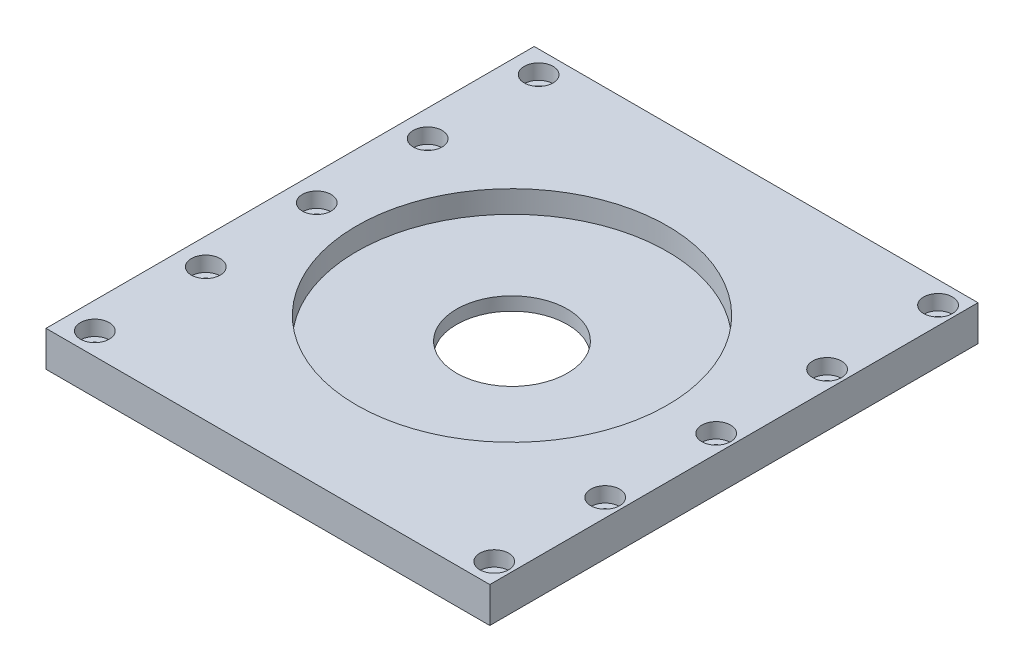
from build123d import *

# Parameters (mm, degrees)
SKETCH1_W                                           = 100
SKETCH1_H                                           = 110
BOSS_EXTRUDE1_DEPTH                                 = 8
CBORE_FOR_M3_HEX_SOCKET_HEAD_CAP_SCREW1_D           = 3.4
CBORE_FOR_M3_HEX_SOCKET_HEAD_CAP_SCREW1_DEPTH       = 8
CBORE_FOR_M3_HEX_SOCKET_HEAD_CAP_SCREW1_CBORE_D     = 6.5
CBORE_FOR_M3_HEX_SOCKET_HEAD_CAP_SCREW1_CBORE_DEPTH = 3.4
CBORE_FOR_M3_HEX_SOCKET_HEAD_CAP_SCREW1_TIP         = 1.021463052
F_25_0MM_DOWEL_HOLE1_D                              = 25
F_25_0MM_DOWEL_HOLE1_DEPTH                          = 10
F_25_0MM_DOWEL_HOLE1_TIP                            = 7.510757738
SKETCH7_R                                           = 35
CUT_EXTRUDE1_DEPTH                                  = 5


with BuildPart() as part:
    # Sketch1 → Boss-Extrude1 (new body)
    with BuildSketch(Plane(origin=(0, 0, 0), x_dir=(1, 0, 0), z_dir=(0, 1, 0))):
        with Locations((50, 55)):
            Rectangle(SKETCH1_W, SKETCH1_H)
    extrude(amount=BOSS_EXTRUDE1_DEPTH)

    # CBORE for M3 Hex Socket Head Cap Screw1
    with Locations(Plane(origin=(0, 8, 0), x_dir=(1, 0, 0), z_dir=(0, 1, 0))):
        with Locations((96, 105), (6, 105), (6, 80), (6, 55), (6, 30), (6, 5), (96, 55), (96, 30), (96, 5), (96, 80)):
            CounterBoreHole(CBORE_FOR_M3_HEX_SOCKET_HEAD_CAP_SCREW1_D / 2, CBORE_FOR_M3_HEX_SOCKET_HEAD_CAP_SCREW1_CBORE_D / 2, CBORE_FOR_M3_HEX_SOCKET_HEAD_CAP_SCREW1_CBORE_DEPTH, depth=CBORE_FOR_M3_HEX_SOCKET_HEAD_CAP_SCREW1_DEPTH)
            with Locations((0, 0, -(CBORE_FOR_M3_HEX_SOCKET_HEAD_CAP_SCREW1_DEPTH + CBORE_FOR_M3_HEX_SOCKET_HEAD_CAP_SCREW1_TIP / 2))):  # 118° drill point
                Cone(0, CBORE_FOR_M3_HEX_SOCKET_HEAD_CAP_SCREW1_D / 2, CBORE_FOR_M3_HEX_SOCKET_HEAD_CAP_SCREW1_TIP, mode=Mode.SUBTRACT)

    # Ø25.0mm Dowel Hole1
    with Locations(Plane(origin=(0, 8, 0), x_dir=(1, 0, 0), z_dir=(0, 1, 0))):
        with Locations((50, 55)):
            Hole(F_25_0MM_DOWEL_HOLE1_D / 2, depth=F_25_0MM_DOWEL_HOLE1_DEPTH)
            with Locations((0, 0, -(F_25_0MM_DOWEL_HOLE1_DEPTH + F_25_0MM_DOWEL_HOLE1_TIP / 2))):  # 118° drill point
                Cone(0, F_25_0MM_DOWEL_HOLE1_D / 2, F_25_0MM_DOWEL_HOLE1_TIP, mode=Mode.SUBTRACT)

    # Sketch7 → Cut-Extrude1 (cut)
    with BuildSketch(Plane(origin=(0, 8, 0), x_dir=(1, 0, 0), z_dir=(0, 1, 0))):
        with Locations((50, 55)):
            Circle(SKETCH7_R)
    extrude(amount=-CUT_EXTRUDE1_DEPTH, mode=Mode.SUBTRACT)


solid = part.part
